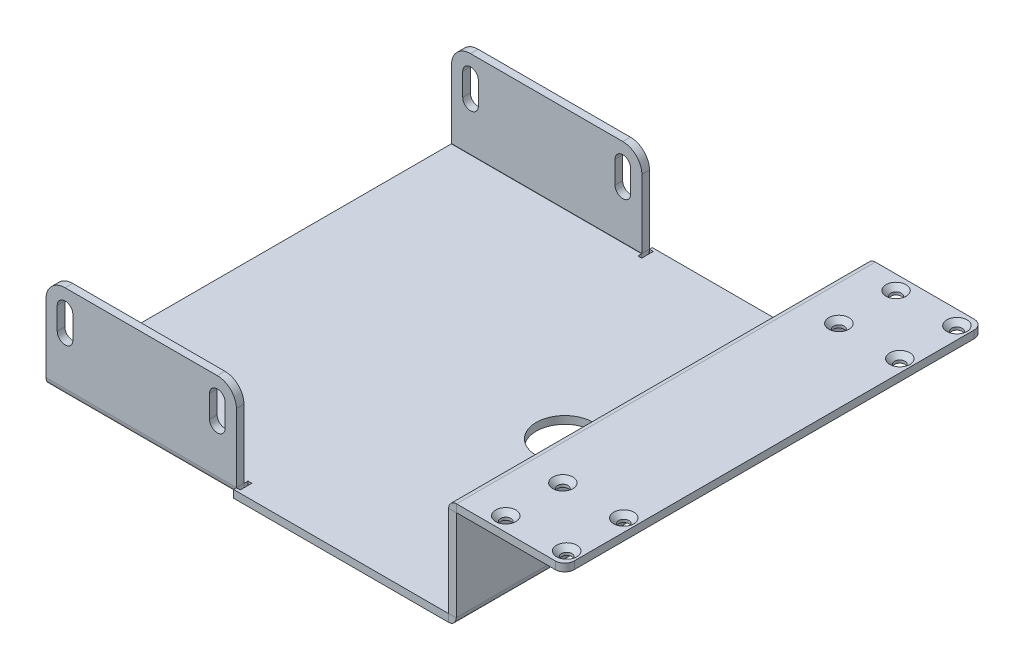
from build123d import *

# Parameters (mm, degrees)
SM_BASE_FLANGE_1_DEPTH      = 110
HOLE_WIZARD_1_D             = 5.5
HOLE_WIZARD_1_CSINK_D       = 10.6
HOLE_WIZARD_1_CSINK_ANGLE   = 90
HOLE_WIZARD_M3_1_D          = 2.5
CUT_EXTRUDE_2_REACH         = 250.783
SKETCH_19_R                 = 15
FILLET_1_R                  = 5
SKETCH_20_W                 = 100
SKETCH_20_H                 = 1.5
CUT_EXTRUDE_3_DEPTH         = 10
SM_START                    = -217
SM_EDGE_FLANGE_2_DEPTH      = 102
SM_START_2                  = -117
SM_EDGE_FLANGE_2_2_DEPTH    = 2
SM_EDGE_FLANGE_2_3_DEPTH    = 100
HOLE_START                  = -108.5
HOLE_WIZARD_8_2_8_2_1_DEPTH = 4
FILLET_2_R                  = 10


# Read off the part's stored shape, not the designer's step: 边线-法兰2, Ø8.2 (8.2) 直径槽口1
# Sheet-metal steps are written as plain solids
with BuildPart() as part:
    # Sketch1 → 基体-法兰1 (new, symmetric)
    with BuildSketch(Plane.XY):
        with BuildLine():
            Line((-217, 0), (-4.1, 0))
            ThreePointArc((-4.1, 0), (-1.200862197, 1.200862197), (0, 4.1))
            Line((0, 4.1), (0, 51.9))
            ThreePointArc((0, 51.9), (0.029289322, 51.970710678), (0.1, 52))
            Line((0.1, 52), (57, 52))
            Line((57, 52), (57, 56))
            Line((57, 56), (0.1, 56))
            ThreePointArc((0.1, 56), (-2.799137803, 54.799137803), (-4, 51.9))
            Line((-4, 51.9), (-4, 4.1))
            ThreePointArc((-4, 4.1), (-4.029289322, 4.029289322), (-4.1, 4))
            Line((-4.1, 4), (-217, 4))
            Line((-217, 4), (-217, 0))
        make_face()
    extrude(amount=SM_BASE_FLANGE_1_DEPTH, both=True)

    # 打孔尺寸开槽半沉头螺钉的类型1 (through all)
    with Locations(Plane(origin=(0, 56, 0), x_dir=(1, 0, 0), z_dir=(0, 1, 0))):
        with Locations((18.5, -102.5), (18.5, -72.5), (50.5, -72.5), (50.5, -102.5)):
            hole_wizard_1 = CounterSinkHole(HOLE_WIZARD_1_D / 2, HOLE_WIZARD_1_CSINK_D / 2, counter_sink_angle=HOLE_WIZARD_1_CSINK_ANGLE)

    # 镜向2: 打孔尺寸开槽半沉头螺钉的类型1 across plane
    add(hole_wizard_1.mirror(Plane.XY), mode=Mode.SUBTRACT)

    # M3 螺纹孔1 (through all)
    with Locations(Plane(origin=(0, 4, 0), x_dir=(1, 0, 0), z_dir=(0, 1, 0))):
        with Locations((-15.5, 8), (-15.5, -8)):
            Hole(HOLE_WIZARD_M3_1_D / 2)

    # 草图19 → 切除-拉伸2 (cut, up to next)
    with BuildSketch(Plane(origin=(0, 4, 0), x_dir=(1, 0, 0), z_dir=(0, 1, 0)), mode=Mode.PRIVATE) as cut_extrude_2_sk1:
        with Locations(Location((-53, 0, 0), (0, 0, 270))):
            Circle(SKETCH_19_R)
    cut_extrude_2_tool1 = extrude(cut_extrude_2_sk1.sketch, amount=-CUT_EXTRUDE_2_REACH, mode=Mode.PRIVATE) & part.part
    add(cut_extrude_2_tool1.solids().sort_by_distance((-53, 4, 0))[0], mode=Mode.SUBTRACT)

    # 圆角1
    fillet_1_edges = [part.edges().sort_by_distance(p)[0] for p in [
        (57, 54, 110),
        (57, 54, -110),
    ]]
    fillet(fillet_1_edges, radius=FILLET_1_R)

    # 草图20 → 切除-拉伸3 (cut)
    with BuildSketch(Plane(origin=(0, 4, 0), x_dir=(1, 0, 0), z_dir=(0, 1, 0))):
        with Locations((-167, 109.25)):
            Rectangle(SKETCH_20_W, SKETCH_20_H)
    cut_extrude_3 = extrude(amount=-CUT_EXTRUDE_3_DEPTH, mode=Mode.SUBTRACT)

    # 镜向5: 切除-拉伸3 across plane
    add(cut_extrude_3.mirror(Plane.XY), mode=Mode.SUBTRACT)

    # 边线-法兰2 outline → 边线-法兰2 (cut)
    with BuildSketch(Plane.YZ.offset(SM_START)):
        with BuildLine():
            ThreePointArc((4, -108.498780306), (1.16571985, -107.263564213), (0, -104.4))
            Line((0, -104.4), (0, -108.5))
            Line((0, -108.5), (4, -108.5))
            Line((4, -108.5), (4, -108.498780306))
        make_face()
    sm_edge_flange_2 = extrude(amount=SM_EDGE_FLANGE_2_DEPTH, mode=Mode.SUBTRACT)

    # Sm Edge Flange 2 2 outline → Sm Edge Flange 2 2 (cut)
    with BuildSketch(Plane.YZ.offset(SM_START_2)):
        with BuildLine():
            Line((4, -102.4), (0, -102.4))
            Line((0, -102.4), (0, -104.4))
            ThreePointArc((0, -104.4), (1.16571985, -107.263564213), (4, -108.498780306))
            Line((4, -108.498780306), (4, -102.4))
        make_face()
    sm_edge_flange_2_2 = extrude(amount=SM_EDGE_FLANGE_2_2_DEPTH, mode=Mode.SUBTRACT)

    # Sm Edge Flange 2 3 outline → Sm Edge Flange 2 3 (add)
    with BuildSketch(Plane.YZ.offset(SM_START)):
        with BuildLine():
            ThreePointArc((4.1, -104.5), (4.029289322, -104.470710678), (4, -104.4))
            Line((4, -104.4), (4, -108.498780306))
            ThreePointArc((4, -108.498780306), (4.049996281, -108.499695065), (4.1, -108.5))
            Line((4.1, -108.5), (50, -108.5))
            Line((50, -108.5), (50, -104.5))
            Line((50, -104.5), (4.1, -104.5))
        make_face()
    sm_edge_flange_2_3 = extrude(amount=SM_EDGE_FLANGE_2_3_DEPTH)

    # Ø8.2 (8.2) 直径槽口1 outline → Ø8.2 (8.2) 直径槽口1 (cut)
    with BuildSketch(Plane.XY.offset(HOLE_START)):
        with BuildLine():
            ThreePointArc((-202.9, 39.9), (-207, 44), (-211.1, 39.9))
            Line((-211.1, 39.9), (-211.1, 28.1))
            ThreePointArc((-211.1, 28.1), (-207, 24), (-202.9, 28.1))
            Line((-202.9, 28.1), (-202.9, 39.9))
        make_face()
        with BuildLine():
            ThreePointArc((-122.9, 39.9), (-127, 44), (-131.1, 39.9))
            Line((-131.1, 39.9), (-131.1, 28.1))
            ThreePointArc((-131.1, 28.1), (-127, 24), (-122.9, 28.1))
            Line((-122.9, 28.1), (-122.9, 39.9))
        make_face()
    hole_wizard_8_2_8_2_1 = extrude(amount=HOLE_WIZARD_8_2_8_2_1_DEPTH, mode=Mode.SUBTRACT)

    # 镜向6: 边线-法兰2, Sm Edge Flange 2 2, Sm Edge Flange 2 3, Ø8.2 (8.2) 直径槽口1 across plane
    add(sm_edge_flange_2.mirror(Plane.XY), mode=Mode.SUBTRACT)
    add(sm_edge_flange_2_2.mirror(Plane.XY), mode=Mode.SUBTRACT)
    add(sm_edge_flange_2_3.mirror(Plane.XY))
    add(hole_wizard_8_2_8_2_1.mirror(Plane.XY), mode=Mode.SUBTRACT)

    # 圆角2
    fillet_2_edges = [part.edges().sort_by_distance(p)[0] for p in [
        (-117, 50, -106.5),
        (-217, 50, -106.5),
        (-217, 50, 106.5),
        (-117, 50, 106.5),
    ]]
    fillet(fillet_2_edges, radius=FILLET_2_R)


solid = part.part
